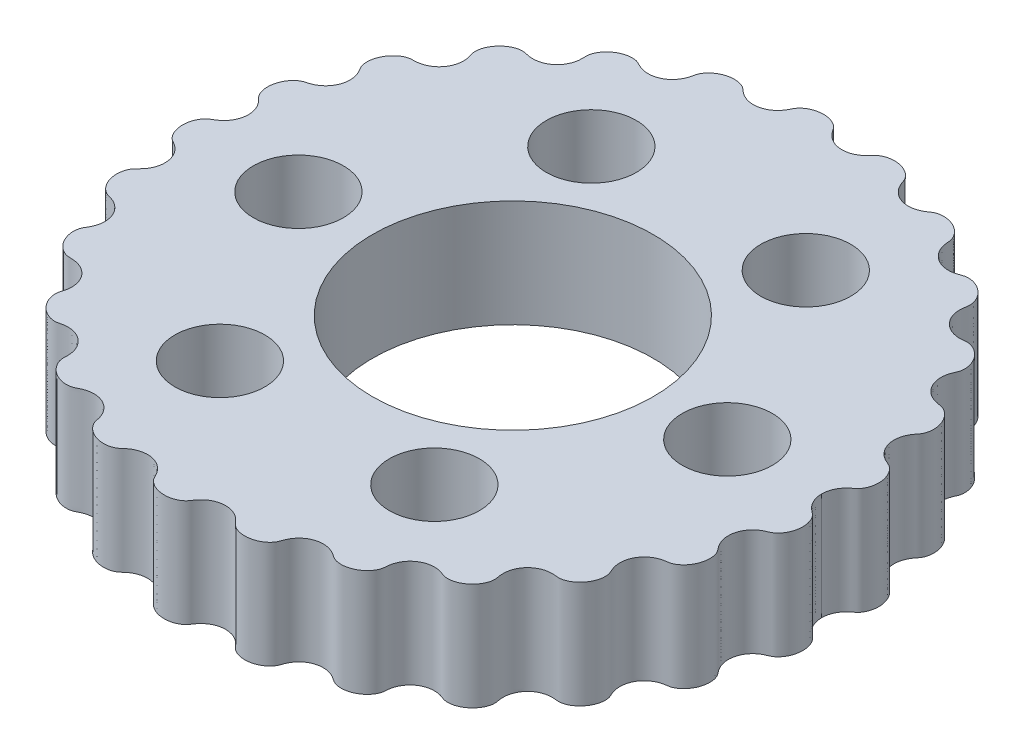
from build123d import *

# Parameters (mm, degrees)
BOSS_EXTRUDE1_DEPTH = 5
SKETCH3_R           = 2.1
CUT_EXTRUDE1_DEPTH  = 23.326267348
SKETCH5_R           = 6.55
CUT_EXTRUDE2_DEPTH  = 23.326267348


with BuildPart() as part:
    # Sketch2 → Boss-Extrude1 (new body)
    with BuildSketch(Plane(origin=(0, 0, 0), x_dir=(1, 0, 0), z_dir=(0, 1, 0))):
        with BuildLine():
            add(Edge.make_bspline(
                [(14.4, -2.48e-07), (14.4, -0.017964131), (14.400999323, -0.054156008), (14.405496279, -0.12324579), (14.417452588, -0.205733979), (14.435300772, -0.284761116), (14.45893618, -0.363830072), (14.495530695, -0.46010355), (14.553831721, -0.577672937), (14.628963244, -0.690475456), (14.720523686, -0.795156479), (14.809877886, -0.878529951), (14.885972343, -0.939710566), (14.965266253, -0.996877467), (15.039390274, -1.060755974), (15.101813025, -1.136527175), (15.154322573, -1.219306863), (15.208602362, -1.329233091), (15.256294433, -1.468797492), (15.288096968, -1.638084003), (15.294503312, -1.881018198), (15.252297927, -2.119868214), (15.163760046, -2.344380457), (15.042398399, -2.523140326), (14.942454238, -2.628650823), (14.84531186, -2.703604014), (14.757199304, -2.750371405), (14.664408479, -2.786732589), (14.573413051, -2.826966073), (14.463621811, -2.885730431), (14.30896843, -2.99023977), (14.130503739, -3.165844964), (13.97214753, -3.43499314), (13.893985611, -3.773342211), (13.916927587, -4.080339103), (13.995171076, -4.31020064), (14.08241223, -4.468542212), (14.150259365, -4.567703904), (14.210025718, -4.642870515), (14.270573552, -4.717649373), (14.320176209, -4.800200779), (14.365416677, -4.910919215), (14.399338348, -5.049561823), (14.416852099, -5.26239869), (14.384339959, -5.500937731), (14.304055891, -5.731023632), (14.177985992, -5.941781926), (14.047854196, -6.09573186), (13.910788986, -6.208565852), (13.777136588, -6.284416414), (13.654566215, -6.325933937), (13.550559771, -6.34133553), (13.446683486, -6.355615469), (13.344145731, -6.378219503), (13.218558644, -6.416412813), (13.049117811, -6.490187976), (12.850381057, -6.623877128), (12.649361495, -6.848376812), (12.506075198, -7.152262136), (12.462998251, -7.451003127), (12.489971746, -7.692058544), (12.539204468, -7.862350677), (12.58028645, -7.968000593), (12.618269622, -8.05035295), (12.654435266, -8.133644712), (12.678283575, -8.221362625), (12.692937759, -8.335981179), (12.690655472, -8.476153448), (12.654302956, -8.685493534), (12.545223608, -8.951239132), (12.373056799, -9.183722876), (12.149188229, -9.366304736), (11.953263909, -9.463318322), (11.811585985, -9.506241427), (11.686731299, -9.522483952), (11.583488414, -9.516968845), (11.481158005, -9.503432911), (11.378198356, -9.496859163), (11.27492891, -9.498212556), (11.172138152, -9.508022579), (11.00848965, -9.53818977), (10.791017774, -9.615836424), (10.543764649, -9.778692295), (10.347433573, -10.024278355), (10.24020892, -10.268607422), (10.194325427, -10.484243678), (10.185347382, -10.638429728), (10.193136342, -10.770510313), (10.209145906, -10.879533536), (10.225592928, -10.966240334), (10.235972153, -11.053921901), (10.233096033, -11.142311619), (10.215768495, -11.253426268), (10.176715504, -11.384209786), (10.088556978, -11.571773091), (9.914554743, -11.800570757), (9.643928691, -12.015790427), (9.338393465, -12.131431598), (9.092328038, -12.151919652), (8.938831082, -12.124722439), (8.874147562, -12.10491764), (8.823296452, -12.08626675), (8.760021443, -12.062210467), (8.657742174, -12.026792627), (8.51270826, -11.991319701), (8.295427931, -11.971044702), (8.023341789, -12.005783546), (7.739745144, -12.120021341), (7.477485771, -12.330308645), (7.309270878, -12.575786103), (7.227745229, -12.796401843), (7.194847234, -12.964652252), (7.183072937, -13.072922936), (7.177409691, -13.159952141), (7.163855658, -13.268191686), (7.120743744, -13.396146509), (7.043211227, -13.53573222), (6.896275027, -13.715388699), (6.667817372, -13.896296354), (6.347778495, -14.038713244), (6.019984619, -14.072733936), (5.761854657, -14.026889945), (5.598537574, -13.9438235), (5.512636, -13.880075243), (5.401772721, -13.805681202), (5.259871252, -13.730304377), (5.052430943, -13.656485505), (4.773826567, -13.622953403), (4.462558539, -13.668320481), (4.188838479, -13.799904328), (3.991154483, -13.966548105), (3.85783339, -14.133925722), (3.78259476, -14.263163115), (3.730894761, -14.379946807), (3.695922871, -14.480037823), (3.668902786, -14.560560916), (3.625075946, -14.65731075), (3.549395473, -14.764707093), (3.439982071, -14.875186556), (3.255657122, -15.006023014), (2.992826186, -15.12014402), (2.651468448, -15.175703585), (2.340640026, -15.129056213), (2.125824212, -15.033765178), (2.01095168, -14.946774732), (1.969758957, -14.909017393), (1.931738615, -14.868052651), (1.895415502, -14.825543114), (1.849862653, -14.772584168), (1.773475414, -14.691023973), (1.657606841, -14.589329712), (1.467715812, -14.468702272), (1.201269864, -14.374829544), (0.894275687, -14.35178124), (0.570472276, -14.423576672), (0.317305019, -14.563244131), (0.151543737, -14.714094099), (0.048134733, -14.841768382), (-0.011408, -14.928872831), (-0.056991615, -15.000049359), (-0.120513991, -15.084516969), (-0.216681119, -15.171117243), (-0.345492256, -15.252082149), (-0.548378411, -15.335584257), (-0.812768968, -15.385412436), (-1.083981162, -15.372591), (-1.344980225, -15.297228229), (-1.543454077, -15.192187965), (-1.665765334, -15.097631249), (-1.754670924, -15.002004579), (-1.811225099, -14.912765423), (-1.848285474, -14.836852784), (-1.894840642, -14.742230285), (-1.981133414, -14.596440624), (-2.130461975, -14.41529174), (-2.371748068, -14.237402882), (-2.694147074, -14.12430371), (-3.005808219, -14.112082243), (-3.27980323, -14.174237527), (-3.481366461, -14.271328267), (-3.607738638, -14.35811219), (-3.692851155, -14.429557516), (-3.744274314, -14.476276993), (-3.785484942, -14.513602659), (-3.839037634, -14.557815957), (-3.971848421, -14.642560884), (-4.209212537, -14.71633601), (-4.537870574, -14.723205644), (-4.870973603, -14.623309475), (-5.119165063, -14.474113271), (-5.287203238, -14.31612745), (-5.381819707, -14.188748958), (-5.441587137, -14.06862443), (-5.469754906, -13.963936343), (-5.486205657, -13.878818164), (-5.510616073, -13.773375732), (-5.562786354, -13.611201417), (-5.668640559, -13.402850243), (-5.861502161, -13.180790139), (-6.140858341, -13.003604858), (-6.432389467, -12.920478649), (-6.707047509, -12.913935003), (-6.924587844, -12.957968071), (-7.070503085, -13.011926038), (-7.171893159, -13.06122639), (-7.234172994, -13.094293424), (-7.284238774, -13.120335774), (-7.348454987, -13.149382122), (-7.450393388, -13.181304909), (-7.592860605, -13.199324175), (-7.822504876, -13.18751304), (-8.108179682, -13.101881323), (-8.360700489, -12.948081014), (-8.564055044, -12.739256852), (-8.686860825, -12.541024859), (-8.745859512, -12.39133299), (-8.771139873, -12.257944389), (-8.769724063, -12.14815779), (-8.764489294, -12.060598983), (-8.763284318, -11.951024196), (-8.773134952, -11.821211292), (-8.801859902, -11.673188778), (-8.872938117, -11.471739551), (-9.004528991, -11.249997896), (-9.220498673, -11.035105879), (-9.499738451, -10.890461106), (-9.747534163, -10.836884111), (-9.938296626, -10.832212303), (-10.067515746, -10.843723353), (-10.16983799, -10.860856705), (-10.270401867, -10.885914711), (-10.371725416, -10.908894526), (-10.499541343, -10.914402223), (-10.649899927, -10.893031168), (-10.864422553, -10.823594557), (-11.115447437, -10.67017858), (-11.318488792, -10.460804265), (-11.461427127, -10.21187442), (-11.524753371, -10.013390682), (-11.546392318, -9.877676724), (-11.548710475, -9.764592888), (-11.539340488, -9.676133867), (-11.51689895, -9.590205974), (-11.489593691, -9.505763504), (-11.460576992, -9.398790066), (-11.437116489, -9.267754038), (-11.428039041, -9.112623117), (-11.448899856, -8.891731429), (-11.525306922, -8.644377974), (-11.680560347, -8.391693336), (-11.908335499, -8.189291512), (-12.146090041, -8.066430785), (-12.351541248, -8.011177394), (-12.509041632, -7.991838642), (-12.640827037, -7.989459677), (-12.746564356, -7.988165361), (-12.874376095, -7.963827043), (-13.017764848, -7.905878909), (-13.169249477, -7.811410927), (-13.319018326, -7.674673565), (-13.471981971, -7.48051382), (-13.581459114, -7.260882561), (-13.64401371, -7.026574245), (-13.652861352, -6.812938875), (-13.63653963, -6.672849265), (-13.606445966, -6.560513177), (-13.570431599, -6.476445112), (-13.523166392, -6.398236645), (-13.47516984, -6.320636942), (-13.42152346, -6.219947813), (-13.352206861, -6.05560861), (-13.297223541, -5.817804655), (-13.306144326, -5.511230794), (-13.418271159, -5.185791445), (-13.599551019, -4.937284586), (-13.788421992, -4.782569597), (-13.950444631, -4.693121576), (-14.068010882, -4.644080471), (-14.164678518, -4.61208046), (-14.263359035, -4.586967358), (-14.36062291, -4.556202679), (-14.4720648, -4.497212289), (-14.590575081, -4.405386747), (-14.741515897, -4.240875697), (-14.885567969, -3.984038862), (-14.960547494, -3.700012411), (-14.962477183, -3.409355837), (-14.917122765, -3.199363963), (-14.864866345, -3.06554937), (-14.80476262, -2.961266815), (-14.743749732, -2.885984676), (-14.673498739, -2.81936508), (-14.60476009, -2.751453058), (-14.541077611, -2.678634146), (-14.482882478, -2.601335407), (-14.398435183, -2.468447561), (-14.309916031, -2.267780594), (-14.25723967, -1.991629089), (-14.294765542, -1.652710045), (-14.415656703, -1.372496047), (-14.564768549, -1.180601379), (-14.700945739, -1.058516228), (-14.801501711, -0.985659956), (-14.885953488, -0.933564713), (-14.973240538, -0.886145701), (-15.055953201, -0.830914272), (-15.145346025, -0.745701448), (-15.234104596, -0.62787553), (-15.302099659, -0.497915803), (-15.350570884, -0.359468333), (-15.378415718, -0.242179397), (-15.393222637, -0.147286992), (-15.398767777, -0.063517745), (-15.4, -0.021212182), (-15.4, 1.28e-07)],
                knots=[0.062565796, 0.062565796, 0.062565796, 0.062565796, 0.062565796, 0.063859973, 0.06515415, 0.066448326, 0.067742503, 0.06903668, 0.070330857, 0.07291921, 0.075992333, 0.077528894, 0.079065456, 0.080602017, 0.082138578, 0.08367514, 0.085211701, 0.086753761, 0.088295822, 0.091379943, 0.094464064, 0.097548185, 0.103528845, 0.106519174, 0.109509504, 0.111075374, 0.112641243, 0.114207112, 0.115772981, 0.117338851, 0.11890472, 0.122036458, 0.127492162, 0.132947866, 0.138255082, 0.143562297, 0.146585003, 0.148096356, 0.149607709, 0.151119061, 0.152630414, 0.154141767, 0.15565312, 0.158617995, 0.161582869, 0.167512619, 0.170668106, 0.173823593, 0.17697908, 0.180134567, 0.181785014, 0.183435461, 0.185085908, 0.186736355, 0.188386802, 0.190037249, 0.193338142, 0.198333612, 0.203329082, 0.208757311, 0.21418554, 0.217038738, 0.218465337, 0.219891935, 0.221318534, 0.222745133, 0.224171732, 0.225598331, 0.22856804, 0.23153775, 0.237477169, 0.243508984, 0.246524892, 0.2495408, 0.251163787, 0.252786774, 0.254409762, 0.256032749, 0.257655736, 0.259278723, 0.26090171, 0.262524697, 0.268116353, 0.273708009, 0.279232337, 0.2819945, 0.284756664, 0.287531357, 0.288918704, 0.290306051, 0.291693397, 0.293080744, 0.294468091, 0.295855437, 0.298751953, 0.301648468, 0.307441499, 0.313806246, 0.320170993, 0.321874543, 0.322726318, 0.323578093, 0.324429868, 0.325281643, 0.326985192, 0.330392292, 0.333799391, 0.338941908, 0.344084424, 0.349371027, 0.354657629, 0.357399899, 0.358771034, 0.360142168, 0.361513303, 0.362884438, 0.365626708, 0.368571539, 0.37151637, 0.377406032, 0.383827609, 0.390249186, 0.391929851, 0.393610516, 0.39529118, 0.396971845, 0.400333174, 0.403694503, 0.409075747, 0.41445699, 0.419832854, 0.422520785, 0.425208717, 0.427878342, 0.429213155, 0.430547968, 0.431882781, 0.433217593, 0.435887219, 0.438758038, 0.441628857, 0.447370496, 0.453780785, 0.460191075, 0.461070296, 0.461949517, 0.462828738, 0.463707959, 0.46458718, 0.465466401, 0.467224842, 0.470741726, 0.47425861, 0.479541903, 0.484825197, 0.489835983, 0.494846769, 0.497503724, 0.498832202, 0.500160679, 0.501489157, 0.502817634, 0.505474589, 0.508247059, 0.511019529, 0.516564468, 0.52227034, 0.525123276, 0.527976212, 0.530631288, 0.531958826, 0.533286364, 0.534613902, 0.53594144, 0.538596516, 0.543936045, 0.549275574, 0.554531257, 0.559786941, 0.563284399, 0.566781857, 0.568530587, 0.569404951, 0.570279316, 0.57115368, 0.572028045, 0.573776774, 0.580152949, 0.586529123, 0.592383377, 0.595310504, 0.598237631, 0.600962992, 0.602325673, 0.603688354, 0.605051034, 0.606413715, 0.609139076, 0.614392618, 0.619646159, 0.624660447, 0.629674735, 0.633223523, 0.636772312, 0.638546707, 0.639433904, 0.640321101, 0.641208298, 0.642095495, 0.64386989, 0.647025799, 0.650181709, 0.656493529, 0.662419511, 0.665382503, 0.668345494, 0.671104535, 0.672484055, 0.673863575, 0.675243096, 0.676622616, 0.679381657, 0.682041398, 0.68470114, 0.690020622, 0.695473381, 0.700926139, 0.704188253, 0.70581931, 0.707450368, 0.709081425, 0.710712482, 0.712343539, 0.713974596, 0.717095441, 0.720216286, 0.726457975, 0.732286917, 0.735201388, 0.738115858, 0.739511278, 0.740906697, 0.742302116, 0.743697535, 0.745092954, 0.746488373, 0.749279211, 0.752059022, 0.754838832, 0.760398454, 0.765423781, 0.770449108, 0.773768675, 0.777088241, 0.778748025, 0.780407808, 0.782067591, 0.783727374, 0.786901153, 0.790074931, 0.793248709, 0.796422487, 0.802397424, 0.805384893, 0.808372361, 0.809807963, 0.811243566, 0.812679168, 0.81411477, 0.815550372, 0.816985974, 0.819857178, 0.825317904, 0.830778629, 0.835989797, 0.841200965, 0.844404173, 0.846005778, 0.847607382, 0.849208986, 0.85081059, 0.852412194, 0.854013798, 0.857107086, 0.860200373, 0.866386948, 0.872352981, 0.875335998, 0.878319014, 0.879839881, 0.881360748, 0.882881615, 0.884402482, 0.885923349, 0.887444216, 0.888965083, 0.890485949, 0.895823145, 0.90116034, 0.906397405, 0.911634469, 0.914757263, 0.91631866, 0.917880057, 0.919441454, 0.921002851, 0.922564248, 0.924125645, 0.927182053, 0.930238461, 0.931766665, 0.933294869, 0.934823073, 0.936351277, 0.936351277, 0.936351277, 0.936351277, 0.936351277], degree=4))
            add(Edge.make_bspline(
                [(14.4, -2.48e-07), (14.4, 0.017963643), (14.400999324, 0.05415552), (14.405496282, 0.123245302), (14.417452594, 0.20573349), (14.435300779, 0.284760627), (14.458936189, 0.363829582), (14.495530706, 0.46010306), (14.553831735, 0.577672445), (14.628963261, 0.690474962), (14.720523706, 0.795155983), (14.809877908, 0.878529452), (14.885972367, 0.939710066), (14.965266278, 0.996876964), (15.039390301, 1.06075547), (15.101813054, 1.13652667), (15.154322603, 1.219306356), (15.208602395, 1.329232582), (15.25629447, 1.468796983), (15.288097009, 1.638083493), (15.294503359, 1.881017687), (15.25229798, 2.119867705), (15.163760104, 2.34437995), (15.042398462, 2.523139822), (14.942454304, 2.628650321), (14.845311928, 2.703603515), (14.757199373, 2.750370908), (14.664408549, 2.786732094), (14.573413122, 2.82696558), (14.463621883, 2.885729941), (14.308968504, 2.990239283), (14.130503818, 3.165844482), (13.972147616, 3.434992663), (13.893985705, 3.773341735), (13.916927688, 4.080338626), (13.995171183, 4.310200161), (14.082412341, 4.468541732), (14.150259479, 4.567703422), (14.210025833, 4.642870031), (14.270573669, 4.717648888), (14.320176329, 4.800200293), (14.3654168, 4.910918728), (14.399338473, 5.049561335), (14.41685223, 5.262398201), (14.384340096, 5.500937243), (14.304056034, 5.731023146), (14.17798614, 5.941781443), (14.047854348, 6.09573138), (13.91078914, 6.208565376), (13.777136745, 6.284415941), (13.654566372, 6.325933467), (13.550559929, 6.341335063), (13.446683645, 6.355615004), (13.34414589, 6.378219041), (13.218558803, 6.416412354), (13.049117972, 6.490187522), (12.850381222, 6.623876678), (12.649361665, 6.848376367), (12.506075376, 7.152261695), (12.462998437, 7.451002686), (12.489971937, 7.692058103), (12.539204664, 7.862350235), (12.580286648, 7.96800015), (12.618269822, 8.050352506), (12.654435469, 8.133644267), (12.67828378, 8.22136218), (12.692937966, 8.335980733), (12.690655683, 8.476153002), (12.654303173, 8.685493089), (12.545223831, 8.95123869), (12.373057028, 9.183722438), (12.149188462, 9.366304303), (11.953264144, 9.463317894), (11.811586222, 9.506241003), (11.686731537, 9.522483531), (11.583488651, 9.516968426), (11.481158241, 9.503432495), (11.378198593, 9.49685875), (11.274929146, 9.498212146), (11.172138389, 9.508022171), (11.008489887, 9.538189366), (10.791018013, 9.615836025), (10.543764892, 9.778691902), (10.347433822, 10.024277967), (10.240209176, 10.268607037), (10.194325688, 10.484243294), (10.185347647, 10.638429345), (10.19313661, 10.770509929), (10.209146177, 10.879533152), (10.225593201, 10.966239949), (10.235972428, 11.053921516), (10.23309631, 11.142311234), (10.215768775, 11.253425883), (10.176715788, 11.384209403), (10.088557266, 11.57177271), (9.914555037, 11.80057038), (9.64392899, 12.015790057), (9.338393767, 12.131431236), (9.092328341, 12.151919296), (8.938831384, 12.124722086), (8.874147863, 12.104917289), (8.823296753, 12.0862664), (8.760021743, 12.062210119), (8.657742474, 12.026792282), (8.512708559, 11.991319359), (8.295428229, 11.971044365), (8.023342088, 12.005783216), (7.739745446, 12.120021019), (7.477486078, 12.330308329), (7.309271191, 12.575785792), (7.227745548, 12.796401533), (7.194847557, 12.964651943), (7.183073263, 13.072922627), (7.177410019, 13.159951833), (7.163855988, 13.268191378), (7.120744078, 13.396146202), (7.043211564, 13.535731915), (6.896275369, 13.715388397), (6.667817718, 13.896296058), (6.347778845, 14.038712956), (6.019984969, 14.072733656), (5.761855006, 14.026889672), (5.598537921, 13.943823231), (5.512636345, 13.880074976), (5.401773065, 13.805680938), (5.259871594, 13.730304116), (5.052431284, 13.65648525), (4.773826906, 13.622953154), (4.462558879, 13.66832024), (4.188838823, 13.799904094), (3.991154831, 13.966547876), (3.857833742, 14.133925496), (3.782595116, 14.263162891), (3.730895119, 14.379946584), (3.695923232, 14.480037601), (3.668903149, 14.560560695), (3.625076311, 14.65731053), (3.549395841, 14.764706874), (3.439982442, 14.87518634), (3.255657496, 15.006022803), (2.992826562, 15.120143816), (2.651468826, 15.175703389), (2.340640403, 15.129056025), (2.125824586, 15.033764995), (2.010952052, 14.946774553), (1.969759328, 14.909017214), (1.931738985, 14.868052473), (1.895415871, 14.825542937), (1.849863021, 14.772583992), (1.77347578, 14.691023799), (1.657607204, 14.589329541), (1.467716173, 14.468702105), (1.201270222, 14.374829384), (0.894276044, 14.351781087), (0.570472635, 14.423576528), (0.317305382, 14.563243994), (0.151544104, 14.714093965), (0.048135102, 14.841768251), (-0.011407628, 14.928872701), (-0.056991241, 15.000049231), (-0.120513615, 15.084516842), (-0.216680741, 15.171117118), (-0.345491876, 15.252082028), (-0.548378029, 15.33558414), (-0.812768585, 15.385412326), (-1.08398078, 15.372590897), (-1.344979844, 15.297228132), (-1.543453699, 15.192187873), (-1.665764958, 15.097631161), (-1.75467055, 15.002004493), (-1.811224727, 14.912765339), (-1.848285105, 14.8368527), (-1.894840274, 14.742230203), (-1.981133051, 14.596440543), (-2.130461616, 14.415291664), (-2.371747714, 14.237402812), (-2.694146722, 14.124303648), (-3.005807868, 14.112082188), (-3.279802877, 14.174237479), (-3.481366106, 14.271328224), (-3.607738281, 14.35811215), (-3.692850795, 14.429557478), (-3.744273954, 14.476276956), (-3.785484581, 14.513602624), (-3.839037271, 14.557815923), (-3.971848056, 14.642560853), (-4.20921217, 14.716335985), (-4.537870208, 14.723205627), (-4.870973239, 14.623309466), (-5.119164702, 14.474113269), (-5.287202882, 14.316127452), (-5.381819354, 14.188748962), (-5.441586787, 14.068624436), (-5.469754558, 13.96393635), (-5.486205311, 13.878818171), (-5.51061573, 13.77337574), (-5.562786015, 13.611201426), (-5.668640225, 13.402850255), (-5.861501833, 13.180790155), (-6.140858017, 13.003604881), (-6.432389146, 12.92047868), (-6.707047187, 12.91393504), (-6.924587522, 12.957968114), (-7.070502761, 13.011926084), (-7.171892834, 13.061226439), (-7.234172667, 13.094293474), (-7.284238447, 13.120335826), (-7.34845466, 13.149382175), (-7.45039306, 13.181304965), (-7.592860276, 13.199324234), (-7.822504547, 13.187513105), (-8.108179356, 13.101881395), (-8.360700166, 12.948081092), (-8.564054727, 12.739256935), (-8.686860513, 12.541024946), (-8.745859203, 12.391333078), (-8.771139568, 12.257944478), (-8.76972376, 12.148157879), (-8.764488993, 12.060599072), (-8.76328402, 11.951024284), (-8.773134658, 11.821211381), (-8.801859611, 11.673188867), (-8.872937831, 11.471739642), (-9.004528711, 11.249997991), (-9.220498398, 11.035105979), (-9.49973818, 10.890461213), (-9.747533893, 10.836884224), (-9.938296357, 10.832212421), (-10.067515476, 10.843723474), (-10.16983772, 10.860856829), (-10.270401596, 10.885914837), (-10.371725144, 10.908894655), (-10.499541071, 10.914402354), (-10.649899655, 10.893031304), (-10.864422283, 10.823594698), (-11.115447172, 10.670178727), (-11.318488531, 10.460804417), (-11.461426873, 10.211874576), (-11.524753121, 10.01339084), (-11.546392072, 9.877676882), (-11.548710232, 9.764593046), (-11.539340247, 9.676134025), (-11.516898711, 9.590206131), (-11.489593455, 9.50576366), (-11.460576758, 9.398790222), (-11.437116258, 9.267754193), (-11.428038814, 9.112623272), (-11.448899634, 8.891731584), (-11.525306707, 8.644378131), (-11.680560138, 8.391693497), (-11.908335295, 8.189291679), (-12.14608984, 8.066430957), (-12.351541049, 8.011177571), (-12.509041433, 7.991838824), (-12.640826838, 7.989459862), (-12.746564157, 7.988165548), (-12.874375897, 7.963827234), (-13.017764651, 7.905879104), (-13.169249283, 7.811411125), (-13.319018135, 7.674673767), (-13.471981785, 7.480514026), (-13.581458933, 7.260882769), (-13.644013535, 7.026574455), (-13.652861182, 6.812939085), (-13.636539464, 6.672849475), (-13.606445803, 6.560513387), (-13.570431438, 6.47644532), (-13.523166232, 6.398236852), (-13.475169683, 6.320637148), (-13.421523305, 6.219948018), (-13.35220671, 6.055608813), (-13.297223396, 5.817804857), (-13.306144189, 5.511230995), (-13.41827103, 5.18579165), (-13.599550896, 4.937284795), (-13.788421873, 4.78256981), (-13.950444514, 4.693121794), (-14.068010766, 4.644080692), (-14.164678403, 4.612080683), (-14.263358921, 4.586967583), (-14.360622796, 4.556202907), (-14.472064688, 4.497212519), (-14.590574971, 4.40538698), (-14.741515792, 4.240875934), (-14.88556787, 3.984039103), (-14.960547402, 3.700012654), (-14.962477098, 3.40935608), (-14.917122685, 3.199364204), (-14.864866268, 3.065549611), (-14.804762546, 2.961267054), (-14.74374966, 2.885984913), (-14.673498669, 2.819365316), (-14.604760021, 2.751453291), (-14.541077544, 2.678634379), (-14.482882413, 2.601335638), (-14.398435122, 2.46844779), (-14.309915974, 2.267780821), (-14.25723962, 1.991629314), (-14.294765501, 1.652710271), (-14.415656668, 1.372496276), (-14.564768519, 1.180601612), (-14.700945713, 1.058516465), (-14.801501687, 0.985660195), (-14.885953465, 0.933564954), (-14.973240516, 0.886145944), (-15.05595318, 0.830914518), (-15.145346006, 0.745701695), (-15.234104581, 0.62787578), (-15.302099646, 0.497916054), (-15.350570875, 0.359468585), (-15.378415712, 0.24217965), (-15.393222633, 0.147287246), (-15.398767776, 0.063517999), (-15.4, 0.021212436), (-15.4, 1.28e-07)],
                knots=[0.062565796, 0.062565796, 0.062565796, 0.062565796, 0.062565796, 0.063859973, 0.06515415, 0.066448326, 0.067742503, 0.06903668, 0.070330857, 0.07291921, 0.075992333, 0.077528894, 0.079065456, 0.080602017, 0.082138578, 0.08367514, 0.085211701, 0.086753761, 0.088295822, 0.091379943, 0.094464064, 0.097548185, 0.103528845, 0.106519174, 0.109509504, 0.111075374, 0.112641243, 0.114207112, 0.115772981, 0.117338851, 0.11890472, 0.122036458, 0.127492162, 0.132947866, 0.138255082, 0.143562297, 0.146585003, 0.148096356, 0.149607709, 0.151119061, 0.152630414, 0.154141767, 0.15565312, 0.158617995, 0.161582869, 0.167512619, 0.170668106, 0.173823593, 0.17697908, 0.180134567, 0.181785014, 0.183435461, 0.185085908, 0.186736355, 0.188386802, 0.190037249, 0.193338142, 0.198333612, 0.203329082, 0.208757311, 0.21418554, 0.217038738, 0.218465337, 0.219891935, 0.221318534, 0.222745133, 0.224171732, 0.225598331, 0.22856804, 0.23153775, 0.237477169, 0.243508984, 0.246524892, 0.2495408, 0.251163787, 0.252786774, 0.254409762, 0.256032749, 0.257655736, 0.259278723, 0.26090171, 0.262524697, 0.268116353, 0.273708009, 0.279232337, 0.2819945, 0.284756664, 0.287531357, 0.288918704, 0.290306051, 0.291693397, 0.293080744, 0.294468091, 0.295855437, 0.298751953, 0.301648468, 0.307441499, 0.313806246, 0.320170993, 0.321874543, 0.322726318, 0.323578093, 0.324429868, 0.325281643, 0.326985192, 0.330392292, 0.333799391, 0.338941908, 0.344084424, 0.349371027, 0.354657629, 0.357399899, 0.358771034, 0.360142168, 0.361513303, 0.362884438, 0.365626708, 0.368571539, 0.37151637, 0.377406032, 0.383827609, 0.390249186, 0.391929851, 0.393610516, 0.39529118, 0.396971845, 0.400333174, 0.403694503, 0.409075747, 0.41445699, 0.419832854, 0.422520785, 0.425208717, 0.427878342, 0.429213155, 0.430547968, 0.431882781, 0.433217593, 0.435887219, 0.438758038, 0.441628857, 0.447370496, 0.453780785, 0.460191075, 0.461070296, 0.461949517, 0.462828738, 0.463707959, 0.46458718, 0.465466401, 0.467224842, 0.470741726, 0.47425861, 0.479541903, 0.484825197, 0.489835983, 0.494846769, 0.497503724, 0.498832202, 0.500160679, 0.501489157, 0.502817634, 0.505474589, 0.508247059, 0.511019529, 0.516564468, 0.52227034, 0.525123276, 0.527976212, 0.530631288, 0.531958826, 0.533286364, 0.534613902, 0.53594144, 0.538596516, 0.543936045, 0.549275574, 0.554531257, 0.559786941, 0.563284399, 0.566781857, 0.568530587, 0.569404951, 0.570279316, 0.57115368, 0.572028045, 0.573776774, 0.580152949, 0.586529123, 0.592383377, 0.595310504, 0.598237631, 0.600962992, 0.602325673, 0.603688354, 0.605051034, 0.606413715, 0.609139076, 0.614392618, 0.619646159, 0.624660447, 0.629674735, 0.633223523, 0.636772312, 0.638546707, 0.639433904, 0.640321101, 0.641208298, 0.642095495, 0.64386989, 0.647025799, 0.650181709, 0.656493529, 0.662419511, 0.665382503, 0.668345494, 0.671104535, 0.672484055, 0.673863575, 0.675243096, 0.676622616, 0.679381657, 0.682041398, 0.68470114, 0.690020622, 0.695473381, 0.700926139, 0.704188253, 0.70581931, 0.707450368, 0.709081425, 0.710712482, 0.712343539, 0.713974596, 0.717095441, 0.720216286, 0.726457975, 0.732286917, 0.735201388, 0.738115858, 0.739511278, 0.740906697, 0.742302116, 0.743697535, 0.745092954, 0.746488373, 0.749279211, 0.752059022, 0.754838832, 0.760398454, 0.765423781, 0.770449108, 0.773768675, 0.777088241, 0.778748025, 0.780407808, 0.782067591, 0.783727374, 0.786901153, 0.790074931, 0.793248709, 0.796422487, 0.802397424, 0.805384893, 0.808372361, 0.809807963, 0.811243566, 0.812679168, 0.81411477, 0.815550372, 0.816985974, 0.819857178, 0.825317904, 0.830778629, 0.835989797, 0.841200965, 0.844404173, 0.846005778, 0.847607382, 0.849208986, 0.85081059, 0.852412194, 0.854013798, 0.857107086, 0.860200373, 0.866386948, 0.872352981, 0.875335998, 0.878319014, 0.879839881, 0.881360748, 0.882881615, 0.884402482, 0.885923349, 0.887444216, 0.888965083, 0.890485949, 0.895823145, 0.90116034, 0.906397405, 0.911634469, 0.914757263, 0.91631866, 0.917880057, 0.919441454, 0.921002851, 0.922564248, 0.924125645, 0.927182053, 0.930238461, 0.931766665, 0.933294869, 0.934823073, 0.936351277, 0.936351277, 0.936351277, 0.936351277, 0.936351277], degree=4))
        make_face()
    extrude(amount=BOSS_EXTRUDE1_DEPTH)

    # Sketch3 → Cut-Extrude1 (cut, through all)
    with BuildSketch(Plane(origin=(0, 0, 0), x_dir=(1, 0, 0), z_dir=(0, 1, 0))):
        with Locations((10, 0)):
            Circle(SKETCH3_R)
        with Locations((5, -8.660254038)):
            Circle(SKETCH3_R)
        with Locations((-5, -8.660254038)):
            Circle(SKETCH3_R)
        with Locations((-10, 0)):
            Circle(SKETCH3_R)
        with Locations((-5, 8.660254038)):
            Circle(SKETCH3_R)
        with Locations((5, 8.660254038)):
            Circle(SKETCH3_R)
    extrude(amount=CUT_EXTRUDE1_DEPTH, mode=Mode.SUBTRACT)

    # Sketch5 → Cut-Extrude2 (cut, through all)
    with BuildSketch(Plane(origin=(0, 0, 0), x_dir=(1, 0, 0), z_dir=(0, 1, 0))):
        Circle(SKETCH5_R)
    extrude(amount=CUT_EXTRUDE2_DEPTH, mode=Mode.SUBTRACT)


solid = part.part
